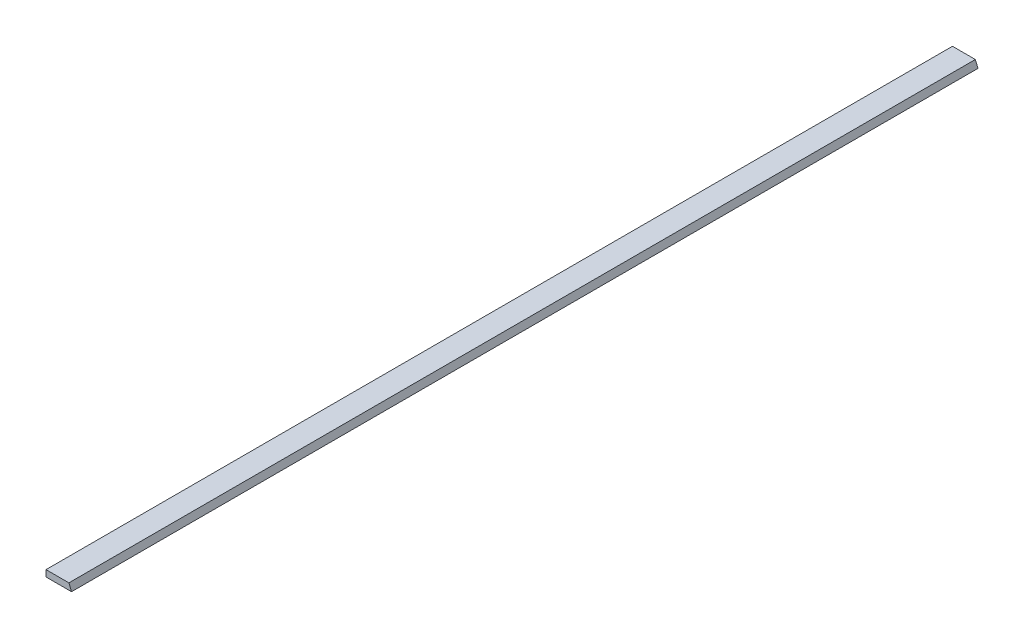
from build123d import *

# Parameters (mm, degrees)
BOSS_EXTRUDE1_DEPTH = 901.7


with BuildPart() as part:
    # Sketch1 → Boss-Extrude1 (new body)
    with BuildSketch(Plane.XY):
        Polygon((0, 0), (0, 6.35), (22.769743879, 6.35), (25.4, 0), align=None)
    extrude(amount=BOSS_EXTRUDE1_DEPTH)


solid = part.part
